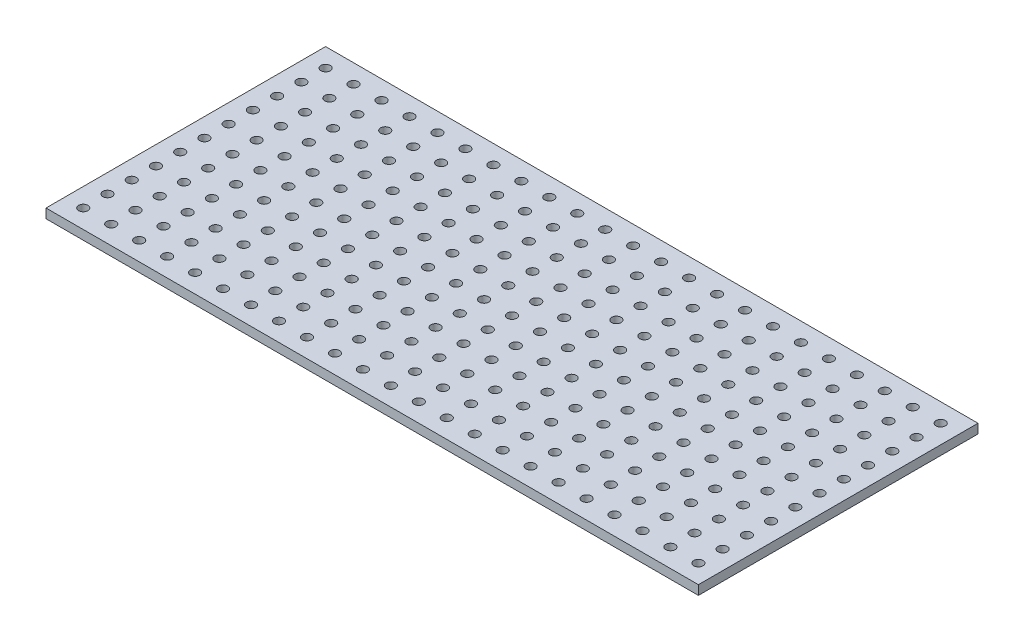
from build123d import *

# Parameters (mm, degrees)
CROQUIS2_W              = 700
CROQUIS2_H              = 300
SALIENTE_EXTRUIR1_DEPTH = 10
CROQUIS3_R              = 5
CORTAR_EXTRUIR1_DEPTH   = 10
MATRIZL1_COUNT          = 11
MATRIZL1_PITCH          = 26
MATRIZL1_COUNT_DIR2     = 23
MATRIZL1_PITCH_DIR2     = 30


with BuildPart() as part:
    # Croquis2 → Saliente-Extruir1 (new body)
    with BuildSketch(Plane(origin=(0, 0, 0), x_dir=(1, 0, 0), z_dir=(0, 1, 0))):
        Rectangle(CROQUIS2_W, CROQUIS2_H)
    extrude(amount=SALIENTE_EXTRUIR1_DEPTH)

    # Croquis3 → Cortar-Extruir1 (cut)
    with BuildSketch(Plane(origin=(0, 10, 0), x_dir=(1, 0, 0), z_dir=(0, 1, 0))):
        with Locations(Location((-330, 130, 0), (0, 0, 270))):
            Circle(CROQUIS3_R)
    cortar_extruir1 = extrude(amount=-CORTAR_EXTRUIR1_DEPTH, mode=Mode.SUBTRACT)

    # MatrizL1: Cortar-Extruir1 11 × 23
    with Locations(*[(j * MATRIZL1_PITCH_DIR2, 0, i * MATRIZL1_PITCH) for i in range(MATRIZL1_COUNT) for j in range(MATRIZL1_COUNT_DIR2) if (i, j) != (0, 0)]):
        add(cortar_extruir1, mode=Mode.SUBTRACT)


solid = part.part
